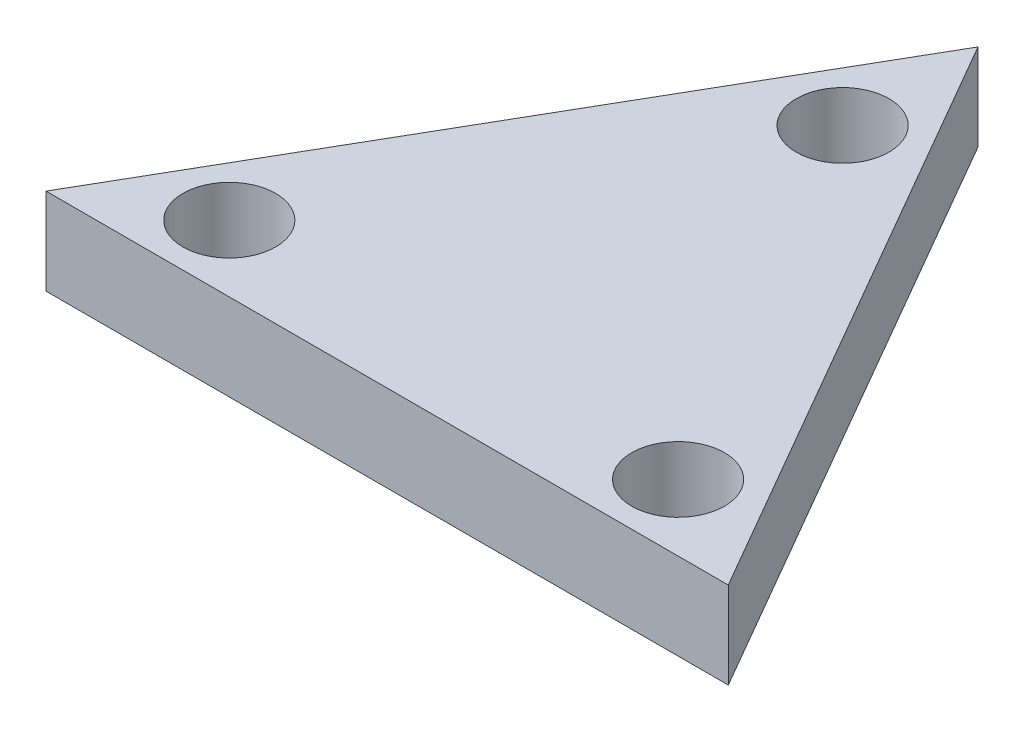
from build123d import *

# Parameters (mm, degrees)
BOSS_EXTRUDE1_DEPTH = 3.175
HOLE1_OUTLINE_R     = 1.7
HOLE1_DEPTH         = 3.175


# Read off the part's stored shape, not the designer's step: Hole1
with BuildPart() as part:
    # Sketch1 → Boss-Extrude1 (new body)
    with BuildSketch(Plane(origin=(0, 0, 0), x_dir=(1, 0, 0), z_dir=(0, 1, 0))):
        Polygon((-0.009590706, 15.307381957), (-12.509590706, -6.343253138), (12.490409294, -6.343253138), align=None)
    extrude(amount=BOSS_EXTRUDE1_DEPTH)

    # Hole1 outline → Hole1 (cut)
    with BuildSketch(Plane(origin=(0, 0, 0), x_dir=(1, 0, 0), z_dir=(0, 1, 0))):
        with Locations((8.221235052, -3.912057057)):
            Circle(HOLE1_OUTLINE_R)
        with Locations((-8.228764373, -3.907710002)):
            Circle(HOLE1_OUTLINE_R)
        with Locations((0, 10.336233865)):
            Circle(HOLE1_OUTLINE_R)
    extrude(amount=HOLE1_DEPTH, mode=Mode.SUBTRACT)


solid = part.part
